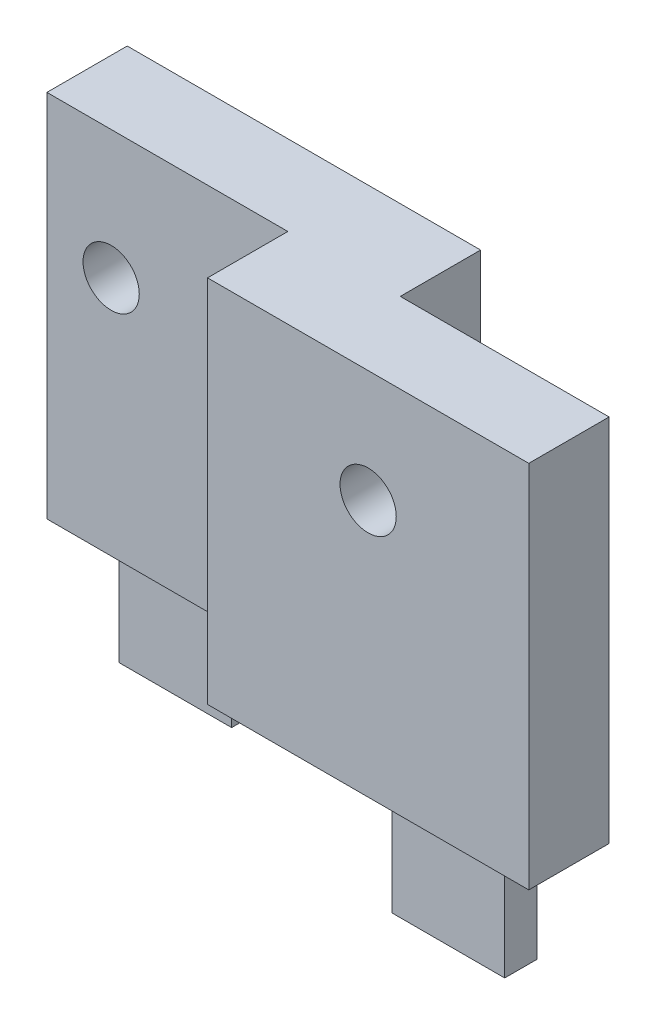
from build123d import *

# Parameters (mm, degrees)
BOSS_EXTRUDE1_DEPTH     = 23
CUT_EXTRUDE1_DEPTH      = 44.058100283
CUT_EXTRUDE1_DEPTH_BACK = 44.058100283
SKETCH2_R               = 1.75
CUT_EXTRUDE2_DEPTH      = 44.058100283
CUT_EXTRUDE2_DEPTH_BACK = 10
SKETCH3_R               = 1.5
SKETCH4_W               = 7
SKETCH4_H               = 2
BOSS_EXTRUDE2_DEPTH     = 7


with BuildPart() as part:
    # Sketch1 → Boss-Extrude1 (new body)
    with BuildSketch(Plane(origin=(0, 0, 0), x_dir=(1, 0, 0), z_dir=(0, 1, 0))):
        Polygon((18, 0), (22, 0), (22, -5), (35, -5), (35, -10), (15, -10), (15, -5), (0, -5), (0, 0), align=None)
    extrude(amount=BOSS_EXTRUDE1_DEPTH)

    # Sketch2 → Cut-Extrude1 (cut, two sides: drawn at the far end of the back side and taken through both)
    with BuildSketch(Plane.XY.offset(10).offset(-CUT_EXTRUDE1_DEPTH_BACK)):
        with Locations((25, 16)):
            Circle(SKETCH2_R)
        with Locations((4, 15)):
            Circle(SKETCH2_R)
    extrude(amount=CUT_EXTRUDE1_DEPTH + CUT_EXTRUDE1_DEPTH_BACK, mode=Mode.SUBTRACT)

    # Sketch3 → Cut-Extrude2 (cut, two sides: drawn at the far end of the back side and taken through both)
    with BuildSketch(Plane.XZ.offset(-CUT_EXTRUDE2_DEPTH_BACK)):
        with Locations((18.5, 5)):
            Circle(SKETCH3_R)
    extrude(amount=CUT_EXTRUDE2_DEPTH + CUT_EXTRUDE2_DEPTH_BACK, mode=Mode.SUBTRACT)

    # Sketch4 → Boss-Extrude2 (add)
    with BuildSketch(Plane.XZ):
        with Locations((6.5, 2.5)):
            Rectangle(SKETCH4_W, SKETCH4_H)
        with Locations((28.5, 7.5)):
            Rectangle(SKETCH4_W, SKETCH4_H)
    extrude(amount=BOSS_EXTRUDE2_DEPTH)


solid = part.part
